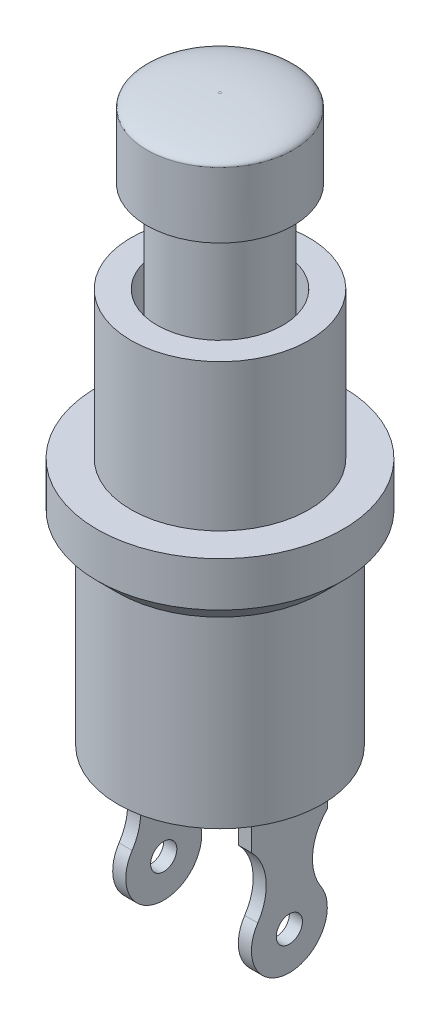
from build123d import *

# Parameters (mm, degrees)
SKETCH1_R               = 3.9
BOSS_EXTRUDE1_DEPTH     = 7
SKETCH2_R               = 4.7
BOSS_EXTRUDE2_DEPTH     = 2.5
CHAMFER1_SIZE           = 0.8
SKETCH3_R               = 3.4
SKETCH3_R_2             = 2.4
BOSS_EXTRUDE3_DEPTH     = 5.6
SKETCH4_R               = 2.05
BOSS_EXTRUDE4_DEPTH     = 9.1
SKETCH5_R               = 2.8
BOSS_EXTRUDE5_DEPTH     = 3
FILLET1_SIZE            = 0.5
FILLET1_SIZE_2          = 2.75
SKETCH6_W               = 0.5
SKETCH6_H               = 2.9
BOSS_EXTRUDE6_DEPTH     = 6.2
CUT_EXTRUDE1_DEPTH      = 6.2
CUT_EXTRUDE1_DEPTH_BACK = 6.2
SKETCH7_R               = 0.5


# Some blends are built 0.0001 mm under size
with BuildPart() as part:
    # Sketch1 → Boss-Extrude1 (new body)
    with BuildSketch(Plane(origin=(0, 0, 0), x_dir=(1, 0, 0), z_dir=(0, 1, 0))):
        with Locations(Location((0, 0, 0), (0, 0, 270))):
            Circle(SKETCH1_R)
    extrude(amount=-BOSS_EXTRUDE1_DEPTH)

    # Sketch2 → Boss-Extrude2 (add)
    with BuildSketch(Plane(origin=(0, 0, 0), x_dir=(1, 0, 0), z_dir=(0, 1, 0))):
        with Locations(Location((0, 0, 0), (0, 0, 270))):
            Circle(SKETCH2_R)
    extrude(amount=BOSS_EXTRUDE2_DEPTH)

    # Chamfer1
    chamfer1_edges = [part.edges().sort_by_distance(p)[0] for p in [
        (0, 0, -4.7),
    ]]
    chamfer(chamfer1_edges, length=CHAMFER1_SIZE - 0.0001)  # a hair under: the kernel refuses the full size

    # Sketch3 → Boss-Extrude3 (add)
    with BuildSketch(Plane(origin=(0, 2.5, 0), x_dir=(1, 0, 0), z_dir=(0, 1, 0))):
        with Locations(Location((0, 0, 0), (0, 0, 270))):
            Circle(SKETCH3_R)
        with Locations(Location((0, 0, 0), (0, 0, 270))):
            Circle(SKETCH3_R_2, mode=Mode.SUBTRACT)
    extrude(amount=BOSS_EXTRUDE3_DEPTH)

    # Sketch4 → Boss-Extrude4 (add)
    with BuildSketch(Plane(origin=(0, 2.5, 0), x_dir=(1, 0, 0), z_dir=(0, 1, 0))):
        with Locations(Location((0, 0, 0), (0, 0, 270))):
            Circle(SKETCH4_R)
    extrude(amount=BOSS_EXTRUDE4_DEPTH)

    # Sketch5 → Boss-Extrude5 (add)
    with BuildSketch(Plane(origin=(0, 11.6, 0), x_dir=(1, 0, 0), z_dir=(0, 1, 0))):
        with Locations(Location((0, 0, 0), (0, 0, 270))):
            Circle(SKETCH5_R)
    extrude(amount=BOSS_EXTRUDE5_DEPTH)

    # Fillet1
    # an asymmetric fillet: 2.75, 0.5 mm, written as the material it takes off along each edge
    with BuildSketch(Plane(origin=(0, 14.6, 0), x_dir=(0, 0, 1), z_dir=(-1, 0, 0))) as fillet1_piece_1:
        with BuildLine():
            Bezier((2.8, -FILLET1_SIZE), (2.8, 0), (2.8 - FILLET1_SIZE_2, 0), weights=[1, 0.707106781, 1])
            Line((2.8 - FILLET1_SIZE_2, 0), (2.8, 0))
            Line((2.8, 0), (2.8, -FILLET1_SIZE))
        make_face()
    revolve(axis=Axis((0, 14.6, 0), (0, 1, 0)), mode=Mode.SUBTRACT)

    # Sketch6 → Boss-Extrude6 (add)
    with BuildSketch(Plane.XZ.offset(7)):
        with Locations((-2.4, 0)):
            Rectangle(SKETCH6_W, SKETCH6_H)
        with Locations((2.4, 0)):
            Rectangle(SKETCH6_W, SKETCH6_H)
    extrude(amount=BOSS_EXTRUDE6_DEPTH)

    # Sketch7 → Cut-Extrude1 (cut, two sides: drawn at the far end of the back side and taken through both)
    with BuildSketch(Plane(origin=(0, 0, 0), x_dir=(0, 0, -1), z_dir=(1, 0, 0)).offset(-CUT_EXTRUDE1_DEPTH_BACK)):
        with BuildLine():
            ThreePointArc((-1.206978138, -10.946443049), (-0.891390932, -9.679801587), (-1.45, -8.5))
            Line((-1.45, -8.5), (-1.45, -11.75))
            ThreePointArc((-1.45, -11.75), (-1.387915397, -11.330249062), (-1.206978138, -10.946443049))
        make_face()
        with BuildLine():
            ThreePointArc((1.45, -11.749999997), (1.025304834, -12.775304832), (0, -13.2))
            Line((0, -13.2), (1.45, -13.2))
            Line((1.45, -13.2), (1.45, -11.749999997))
        make_face()
        with BuildLine():
            ThreePointArc((0, -13.2), (-1.025304833, -12.775304833), (-1.45, -11.75))
            Line((-1.45, -11.75), (-1.45, -13.2))
            Line((-1.45, -13.2), (0, -13.2))
        make_face()
        with BuildLine():
            ThreePointArc((1.206978138, -10.946443049), (1.387915397, -11.330249061), (1.45, -11.749999997))
            Line((1.45, -11.749999997), (1.45, -8.5))
            ThreePointArc((1.45, -8.5), (0.891390932, -9.679801587), (1.206978138, -10.946443049))
        make_face()
        with Locations(Location((0, -11.75, 0), (0, 0, 180))):
            Circle(SKETCH7_R)
    extrude(amount=CUT_EXTRUDE1_DEPTH + CUT_EXTRUDE1_DEPTH_BACK, mode=Mode.SUBTRACT)


solid = part.part
